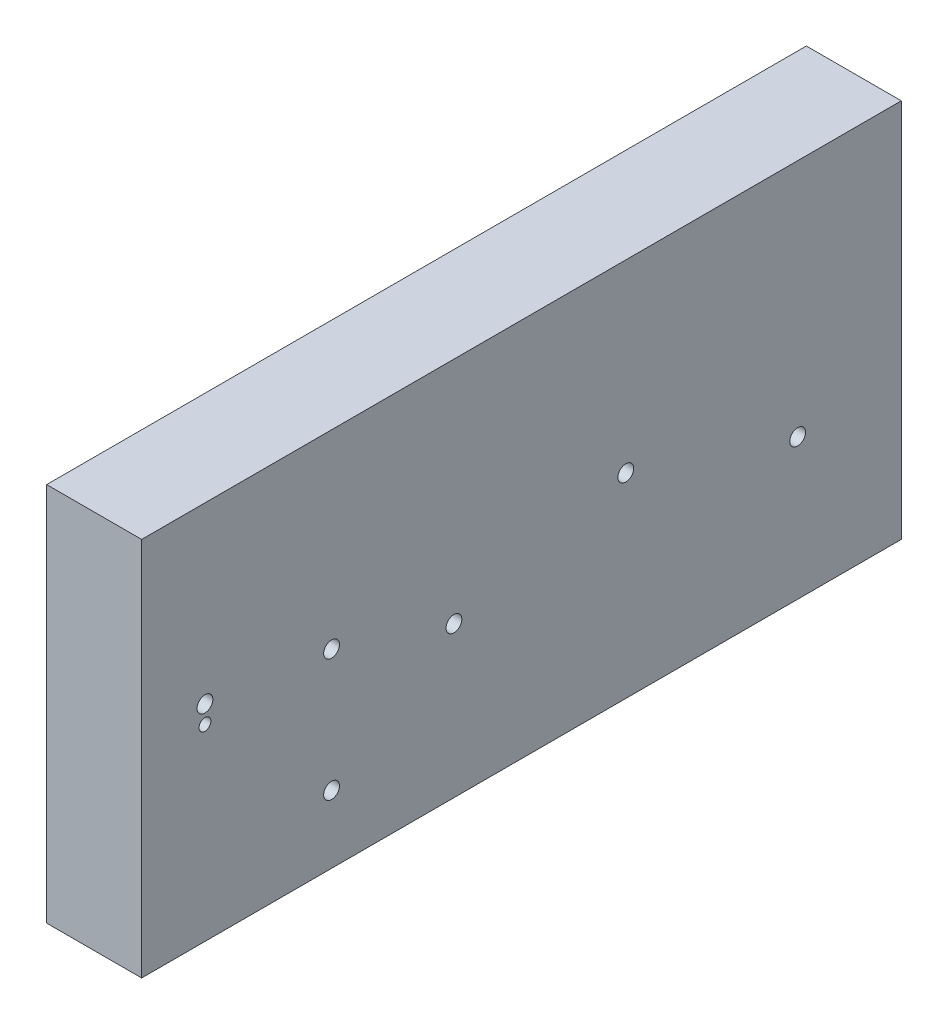
from build123d import *

# Parameters (mm, degrees)
SKETCH1_W                       = 152.4
SKETCH1_H                       = 76.2
SKETCH1_R                       = 1.5875
SKETCH1_R_2                     = 1.190625
BOSS_EXTRUDE1_DEPTH             = 19.05
F_1_4_0_25_DIAMETER_HOLE2_D     = 6.35
F_1_4_0_25_DIAMETER_HOLE2_DEPTH = 12.7
F_1_4_0_25_DIAMETER_HOLE2_TIP   = 1.907732465
SKETCH2_R                       = 4.7625
CUT_EXTRUDE1_DEPTH              = 6.35


with BuildPart() as part:
    # Sketch1 → Boss-Extrude1 (new body)
    with BuildSketch(Plane(origin=(0, 0, 0), x_dir=(0, 0, -1), z_dir=(1, 0, 0))):
        Rectangle(SKETCH1_W, SKETCH1_H)
        with Locations((20.927, 1.096077564)):
            Circle(SKETCH1_R, mode=Mode.SUBTRACT)
        with Locations((-38.1, 0)):
            Circle(SKETCH1_R, mode=Mode.SUBTRACT)
        with Locations((-63.5, 3.175)):
            Circle(SKETCH1_R, mode=Mode.SUBTRACT)
        with Locations((-38.1, -24.55595238)):
            Circle(SKETCH1_R, mode=Mode.SUBTRACT)
        with Locations((-13.55, -7.860160556)):
            Circle(SKETCH1_R, mode=Mode.SUBTRACT)
        with Locations((55.404, -9.873506796)):
            Circle(SKETCH1_R, mode=Mode.SUBTRACT)
        with Locations((-63.5, -0.396875)):
            Circle(SKETCH1_R_2, mode=Mode.SUBTRACT)
    extrude(amount=BOSS_EXTRUDE1_DEPTH)

    # 1/4 (0.25) Diameter Hole2
    with Locations(Plane.XZ.offset(38.1)):
        with Locations((9.525, 57.15), (9.525, -63.5), (9.525, 0)):
            Hole(F_1_4_0_25_DIAMETER_HOLE2_D / 2, depth=F_1_4_0_25_DIAMETER_HOLE2_DEPTH)
            with Locations((0, 0, -(F_1_4_0_25_DIAMETER_HOLE2_DEPTH + F_1_4_0_25_DIAMETER_HOLE2_TIP / 2))):  # 118° drill point
                Cone(0, F_1_4_0_25_DIAMETER_HOLE2_D / 2, F_1_4_0_25_DIAMETER_HOLE2_TIP, mode=Mode.SUBTRACT)

    # Sketch2 → Cut-Extrude1 (cut)
    with BuildSketch(Plane.ZY):
        with Locations((38.1, 0)):
            Circle(SKETCH2_R)
        with Locations((22.202, 0)):
            Circle(SKETCH2_R)
        with Locations((-12.275, 0)):
            Circle(SKETCH2_R)
        with Locations((-46.752, 0)):
            Circle(SKETCH2_R)
    extrude(amount=-CUT_EXTRUDE1_DEPTH, mode=Mode.SUBTRACT)


solid = part.part
